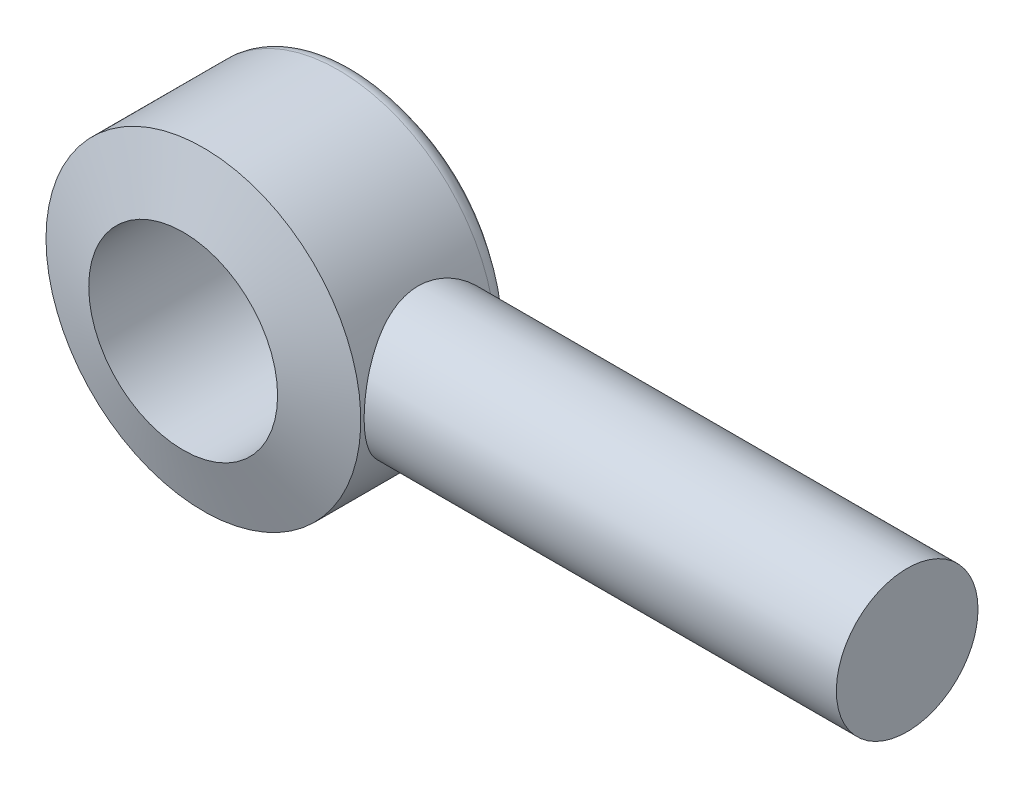
from build123d import *

# Parameters (mm, degrees)
F_3DSKETCH1_R       = 9
BOSS_EXTRUDE3_DEPTH = 65


with BuildPart() as part:
    # Sketch2 → Revolve1 (revolve)
    with BuildSketch(Plane(origin=(0, 0, 0), x_dir=(1, 0, 0), z_dir=(0, 1, 0))):
        with BuildLine():
            Line((12, -12), (20, -9.430177972))
            Line((20, -9.430177972), (20, 7.708755689))
            ThreePointArc((20, 7.708755689), (19.794118127, 8.59257702), (19.218859855, 9.29443556))
            Line((19.218859855, 9.29443556), (17.53901118, 10.585679871))
            ThreePointArc((17.53901118, 10.585679871), (16.963828362, 10.893589151), (16.320151325, 11))
            Line((16.320151325, 11), (12, 11))
            Line((12, 11), (12, 10))
            Line((12, 10), (0, 10))
            Line((0, 10), (0, 7.49732498))
            Line((0, 7.49732498), (12, 7.49732498))
            Line((12, 7.49732498), (12, -12))
        make_face()
    revolve(axis=Axis((0, 0, -10), (0, 0, 1)))

    # 3DSketch1 → Boss-Extrude3 (add)
    with BuildSketch(Plane(origin=(80, 0, 0), x_dir=(0, 0, 1), z_dir=(1, 0, 0))):
        Circle(F_3DSKETCH1_R)
    extrude(amount=-BOSS_EXTRUDE3_DEPTH)


solid = part.part
